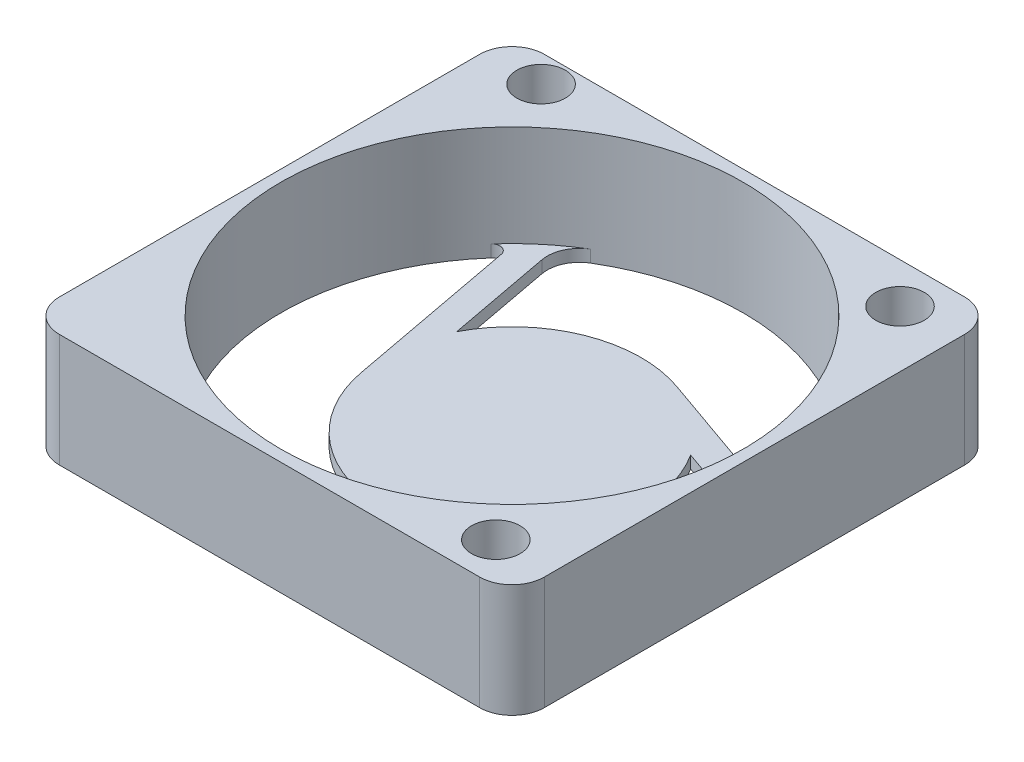
from build123d import *

# Parameters (mm, degrees)
SKETCH1_R        = 1.5
MAINBLOCK_DEPTH  = 7
SKETCH2_R        = 14.3
ROTORSPACE_DEPTH = 6.25
MOTORBASE_DEPTH  = 0.75
FILLET1_R        = 2
FILLET2_R        = 0.5


with BuildPart() as part:
    # Sketch1 → MainBlock (new body)
    with BuildSketch(Plane(origin=(0, 0, 0), x_dir=(1, 0, 0), z_dir=(0, 1, 0))):
        with BuildLine():
            Line((-13, -15), (13, -15))
            ThreePointArc((13, -15), (14.414213562, -14.414213562), (15, -13))
            Line((15, -13), (15, 13))
            ThreePointArc((15, 13), (14.414213562, 14.414213562), (13, 15))
            Line((13, 15), (-13, 15))
            ThreePointArc((-13, 15), (-14.414213562, 14.414213562), (-15, 13))
            Line((-15, 13), (-15, -13))
            ThreePointArc((-15, -13), (-14.414213562, -14.414213562), (-13, -15))
        make_face()
        with Locations(Location((-11.5, 13.3, 0), (0, 0, 270))):
            Circle(SKETCH1_R, mode=Mode.SUBTRACT)
        with Locations(Location((11.5, 12.5, 0), (0, 0, 270))):
            Circle(SKETCH1_R, mode=Mode.SUBTRACT)
        with Locations(Location((11.5, -12.5, 0), (0, 0, 90))):
            Circle(SKETCH1_R, mode=Mode.SUBTRACT)
    extrude(amount=MAINBLOCK_DEPTH)

    # Sketch2 → RotorSpace (cut)
    with BuildSketch(Plane(origin=(0, 7, 0), x_dir=(1, 0, 0), z_dir=(0, 1, 0))):
        with Locations(Location((0, 0, 0), (0, 0, 270))):
            Circle(SKETCH2_R)
    extrude(amount=-ROTORSPACE_DEPTH, mode=Mode.SUBTRACT)

    # Sketch3 → MotorBase (cut)
    with BuildSketch(Plane(origin=(0, 0.75, 0), x_dir=(1, 0, 0), z_dir=(0, 1, 0))):
        with BuildLine():
            ThreePointArc((0.361277738, -7.991838236), (-4.967858622, -6.27059652), (-7.862560494, -1.476530557))
            Line((-7.862560494, -1.476530557), (-10.050196981, 10.172686009))
            ThreePointArc((-10.050196981, 10.172686009), (-14.050704626, -2.658514534), (-5.639005132, -13.141218403))
            Line((-5.639005132, -13.141218403), (0.361277738, -7.991838236))
        make_face()
        with BuildLine():
            ThreePointArc((-7.101773805, 3.683043419), (-2.946566572, 7.437590029), (2.652567275, 7.547442405))
            Line((2.652567275, 7.547442405), (13.834902999, 3.617382894))
            ThreePointArc((13.834902999, 3.617382894), (4.72301119, 13.497524414), (-8.561126408, 11.454130898))
            Line((-8.561126408, 11.454130898), (-7.101773805, 3.683043419))
        make_face()
        with BuildLine():
            Line((14.20013154, 1.687087505), (6.740496067, 4.308794817))
            ThreePointArc((6.740496067, 4.308794817), (7.678670736, 2.244552457), (8, 0))
            ThreePointArc((8, 0), (7.269110872, -3.340662678), (5.209993218, -6.070911848))
            Line((5.209993218, -6.070911848), (-3.784706018, -13.790068903))
            ThreePointArc((-3.784706018, -13.790068903), (8.670891071, -11.371264135), (14.3, 0))
            ThreePointArc((14.3, 0), (14.275011051, 0.845020408), (14.20013154, 1.687087505))
        make_face()
    extrude(amount=-MOTORBASE_DEPTH, mode=Mode.SUBTRACT)

    # Fillet1
    # the kernel refuses this fillet: 2 mm, written as the material it adds along each edge
    with BuildSketch(Plane(origin=(-8.561126408, 0.75, -11.454130898), x_dir=(0.18456631960106568, 0, 0.982820061694366), z_dir=(0, -1, 0)), Plane(origin=(14.20013154, 0.75, -1.687087505), x_dir=(-0.9434303005767882, 0, -0.33157090938981826), z_dir=(0, -1, 0))) as fillet1_piece_1:
        with BuildLine():
            CenterArc((1.313556996, -2), FILLET1_R, 90, 69.537546468)
            ThreePointArc((-0.560245969, -1.300813008), (-0.296237592, -0.643466118), (0, 0))
            Line((0, 0), (1.313556996, 0))
        make_face()
    extrude(amount=0.75)
    with BuildSketch(Plane(origin=(-5.639005132, 0.75, 13.141218403), x_dir=(-0.8983104632101903, 0, -0.43936125419419186), z_dir=(0, -1, 0))) as fillet1_piece_2:
        with BuildLine():
            CenterArc((1.317285733, 1.997546064), FILLET1_R, 203.301017311, 69.537546468)
            Line((-0.519592983, 1.206422444), (0, 0))
            ThreePointArc((0, 0), (0.708164887, -0.017545642), (1.416329774, 0))
        make_face()
    extrude(amount=0.75)

    # Fillet2
    # the kernel refuses this fillet: 0.5 mm, written as the material it adds along each edge
    with BuildSketch(Plane(origin=(13.834902999, 0.75, -3.617382894), x_dir=(-0.9434303005767886, 0, -0.33157090938981726), z_dir=(0, -1, 0)), Plane(origin=(-3.784706018, 0.75, 13.790068903), x_dir=(0.7588639809758072, 0, -0.6512491523046687), z_dir=(0, -1, 0)), Plane(origin=(-10.050196981, 0.75, -10.172686009), x_dir=(0.18456631960117675, 0, 0.982820061694345), z_dir=(0, -1, 0))) as fillet2_piece_1:
        with BuildLine():
            CenterArc((0.981325327, 0.5), FILLET2_R, 141.979598277, 128.020401723)
            ThreePointArc((0.587429586, 0.807971014), (0.286657409, 0.409116528), (0, 0))
            Line((0, 0), (0.981325327, 0))
        make_face()
    extrude(amount=0.75)


solid = part.part
